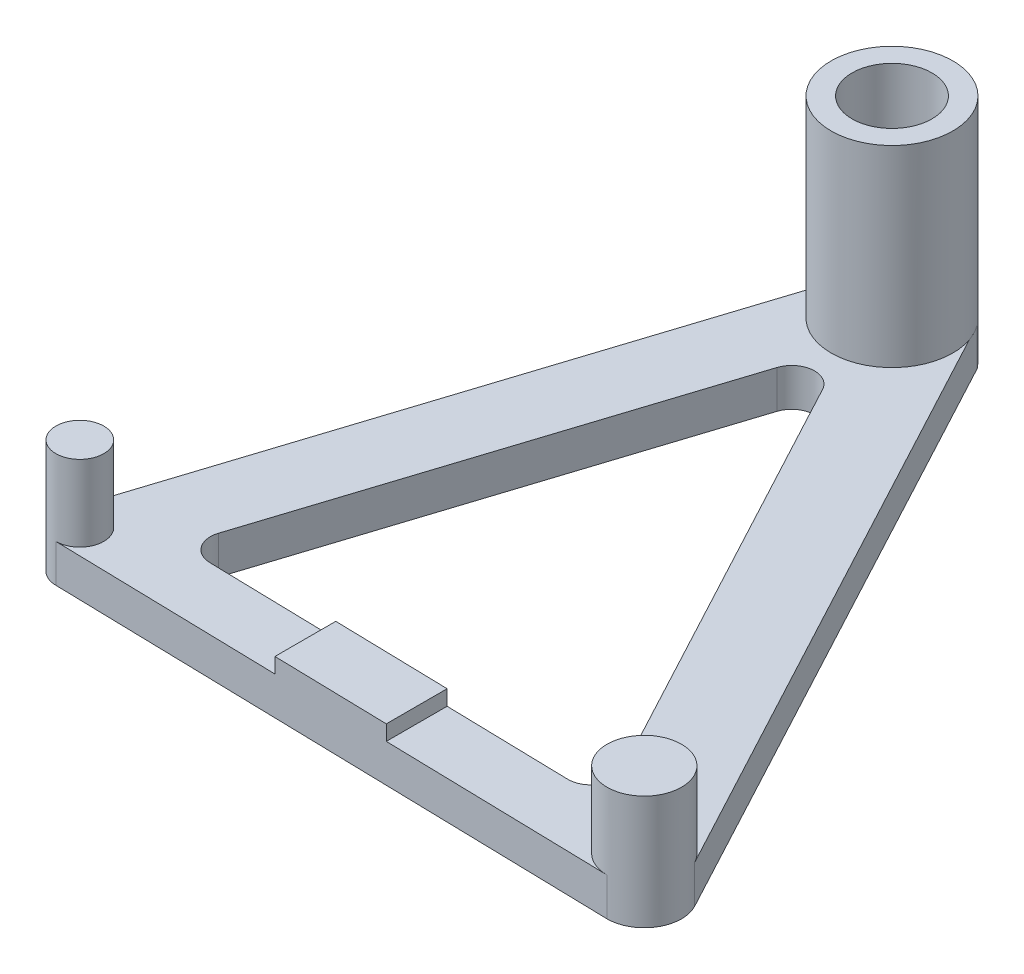
from build123d import *
from build123d.topology import SkipClean

# Parameters (mm, degrees)
SKETCH_1_R          = 4.9
EXTRUDE_1_DEPTH     = 25.3
SKETCH_1_R_2        = 3.15
EXTRUDE_1_2_DEPTH   = 25.3
SKETCH_1_R_3        = 8
SKETCH_1_R_4        = 5.25
EXTRUDE_1_3_DEPTH   = 25.3
EXTRUDE_START       = 5
SKETCH_2_R          = 3.15
EXTRUDE_2_DEPTH     = 5
SKETCH_3_W          = 101.378011207
SKETCH_3_H          = 57.539128355
CUT_EXTRUDE_1_DEPTH = 15.3
CUT_EXTRUDE_2_DEPTH = 100.289108802
FILLET_1_R          = 3
SKETCH_5_R          = 5.25
CUT_EXTRUDE_3_DEPTH = 100.289108802
EXTRUDE_3_DEPTH     = 2


with BuildPart() as part:
    # Эскиз1 → Бобышка-Вытянуть1 (new body)
    with BuildSketch(Plane(origin=(0, 0, 0), x_dir=(1, 0, 0), z_dir=(0, 1, 0))):
        with Locations(Location((44.713737374, -77.299234731, 0), (0, 0, 270))):
            Circle(SKETCH_1_R)
    extrude(amount=EXTRUDE_1_DEPTH)



with BuildPart() as body_2:
    # Эскиз1 → Extrude 1 2 (new body)
    with BuildSketch(Plane(origin=(0, 0, 0), x_dir=(1, 0, 0), z_dir=(0, 1, 0))):
        with Locations(Location((-29.536262626, -77.299234731, 0), (0, 0, 270))):
            Circle(SKETCH_1_R_2)
    extrude(amount=EXTRUDE_1_2_DEPTH)


with BuildPart() as body_3:
    # Эскиз1 → Extrude 1 3 (new body)
    with BuildSketch(Plane(origin=(0, 0, 0), x_dir=(1, 0, 0), z_dir=(0, 1, 0))):
        with Locations(Location((0, 0, 0), (0, 0, 270))):
            Circle(SKETCH_1_R_3)
        with Locations(Location((0, 0, 0), (0, 0, 270))):
            Circle(SKETCH_1_R_4, mode=Mode.SUBTRACT)
    extrude(amount=EXTRUDE_1_3_DEPTH)


with BuildPart() as part_1:
    with SkipClean():  # the faces are left unmerged after this step: merging them gives an invalid solid
        add(part.part)

        add(body_2.part)  # Бобышка-Вытянуть2 merges body 2

        add(body_3.part)  # Бобышка-Вытянуть2 merges body 3
        # Эскиз2 → Бобышка-Вытянуть2 (add)
        with BuildSketch(Plane.XZ.offset(EXTRUDE_START)):
            with BuildLine():
                Line((44.482889179, 82.193793865), (-29.536262626, 80.449234731))
                ThreePointArc((-29.536262626, 80.449234731), (-27.308876266, 79.526621092), (-26.386262626, 77.299234731))
                ThreePointArc((-26.386262626, 77.299234731), (-29.049069338, 74.187138541), (-32.535559579, 76.336572905))
                Line((-32.535559579, 76.336572905), (-7.999251158, -0.109457316))
                ThreePointArc((-7.999251158, -0.109457316), (-2.503564236, -7.598168603), (6.367372109, -4.843198574))
                Line((6.367372109, -4.843198574), (49.035233225, 74.989543494))
                ThreePointArc((49.035233225, 74.989543494), (48.916563034, 79.818412468), (44.713737374, 82.199234731))
                Line((44.713737374, 82.199234731), (44.482889179, 82.193793865))
            make_face()
            with Locations(Location((-29.536262626, 77.299234731, 0), (0, 0, 90))):
                Circle(SKETCH_2_R)
        extrude(amount=-EXTRUDE_2_DEPTH)

    # Эскиз3 → Вырез-Вытянуть1 (cut)
    with SkipClean():  # the faces are left unmerged after this step: merging them gives an invalid solid
        with BuildSketch(Plane(origin=(0, 25.3, 0), x_dir=(1, 0, 0), z_dir=(0, 1, 0))):
            with Locations((10.685297464, -78.742909524)):
                Rectangle(SKETCH_3_W, SKETCH_3_H)
        extrude(amount=-CUT_EXTRUDE_1_DEPTH, mode=Mode.SUBTRACT)

    # Эскиз4 → Вырез-Вытянуть2 (cut, through all)
    with SkipClean():  # the faces are left unmerged after this step: merging them gives an invalid solid
        with BuildSketch(Plane(origin=(0, 0, 0), x_dir=(1, 0, 0), z_dir=(0, 1, 0))):
            Polygon((36.330866648, -73.997214663), (-21.007135718, -72.645813934), (0.235470884, -6.461736097), align=None)
        extrude(amount=-CUT_EXTRUDE_2_DEPTH, mode=Mode.SUBTRACT)

    # Скругление1
    # the kernel refuses this fillet: 3 mm, written as the material it adds along each edge
    with BuildSketch(Plane(origin=(0.235470884, 0, 6.461736097), x_dir=(0.4713655585699632, 0, 0.8819379287648461), z_dir=(0, -1, 0))) as fillet_1_piece_1:
        with BuildLine():
            CenterArc((FILLET_1_R * 2.36056709959, FILLET_1_R), FILLET_1_R, 135.917656387, 134.082343613)
            Line((FILLET_1_R * 1.642226382, FILLET_1_R * 1.69569146426), (0, 0))
            Line((0, 0), (FILLET_1_R * 2.36056709959, 0))
        make_face()
    extrude(amount=5)
    with BuildSketch(Plane(origin=(36.330866648, 0, 73.997214663), x_dir=(-0.4713655585699637, 0, -0.8819379287648459), z_dir=(0, -1, 0))) as fillet_1_piece_2:
        with BuildLine():
            CenterArc((FILLET_1_R * 1.71380475401, -FILLET_1_R), FILLET_1_R, 90, 119.473130073)
            Line((FILLET_1_R * 0.843218222551, -FILLET_1_R * 1.49201533639), (0, 0))
            Line((0, 0), (FILLET_1_R * 1.71380475401, 0))
        make_face()
    extrude(amount=5)
    with BuildSketch(Plane(origin=(-21.007135718, 0, 72.645813934), x_dir=(0.999722366227584, 0, 0.023562480012096054), z_dir=(0, -1, 0))) as fillet_1_piece_3:
        with BuildLine():
            CenterArc((FILLET_1_R * 1.33781102221, -FILLET_1_R), FILLET_1_R, 90, 106.444526314)
            Line((FILLET_1_R * 0.37871675356, -FILLET_1_R * 1.28308688393), (0, 0))
            Line((0, 0), (FILLET_1_R * 1.33781102221, 0))
        make_face()
    extrude(amount=5)

    # Эскиз5 → Вырез-Вытянуть3 (cut, through all)
    with BuildSketch(Plane(origin=(0, 0, 0), x_dir=(1, 0, 0), z_dir=(0, 1, 0))):
        with Locations(Location((0, 0, 0), (0, 0, 90))):
            Circle(SKETCH_5_R)
    extrude(amount=-CUT_EXTRUDE_3_DEPTH, mode=Mode.SUBTRACT)

    # Эскиз6 → Бобышка-Вытянуть3 (add)
    with BuildSketch(Plane(origin=(0, 0, 0), x_dir=(1, 0, 0), z_dir=(0, 1, 0))):
        Polygon((-0.026686724, -73.14030263), (-0.026686724, -81.144746621), (14.973313276, -81.498281975), (14.973313276, -73.493837984), align=None)
    extrude(amount=EXTRUDE_3_DEPTH)


solid = part_1.part
